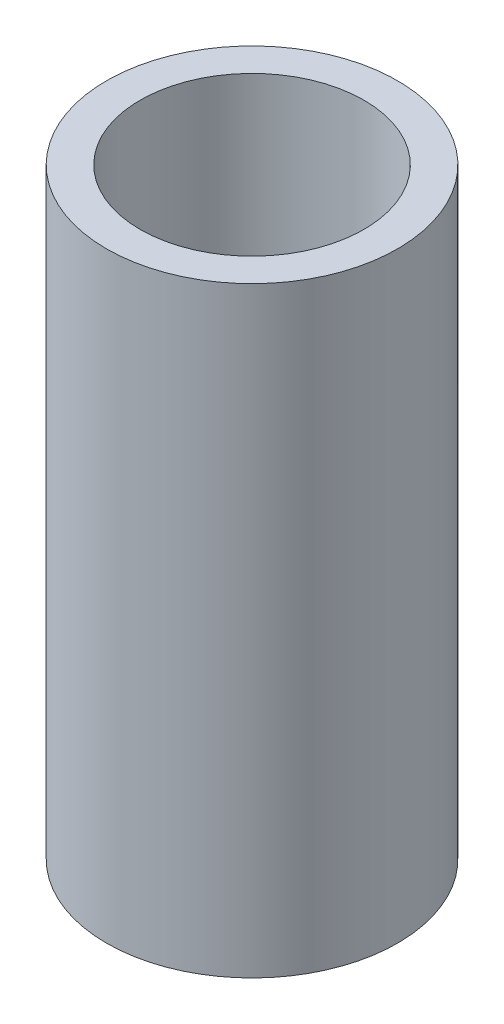
from build123d import *

# Parameters (mm, degrees)
SKETCH1_R           = 15
BOSS_EXTRUDE1_DEPTH = 61.959306041
SKETCH2_R           = 11.535764961
CUT_EXTRUDE1_DEPTH  = 66.490118377


with BuildPart() as part:
    # Sketch1 → Boss-Extrude1 (new body)
    with BuildSketch(Plane(origin=(0, 0, 0), x_dir=(1, 0, 0), z_dir=(0, 1, 0))):
        Circle(SKETCH1_R)
    extrude(amount=BOSS_EXTRUDE1_DEPTH)

    # Sketch2 → Cut-Extrude1 (cut, through all)
    with BuildSketch(Plane(origin=(0, 0, 0), x_dir=(1, 0, 0), z_dir=(0, 1, 0))):
        Circle(SKETCH2_R)
    extrude(amount=CUT_EXTRUDE1_DEPTH, mode=Mode.SUBTRACT)


solid = part.part
